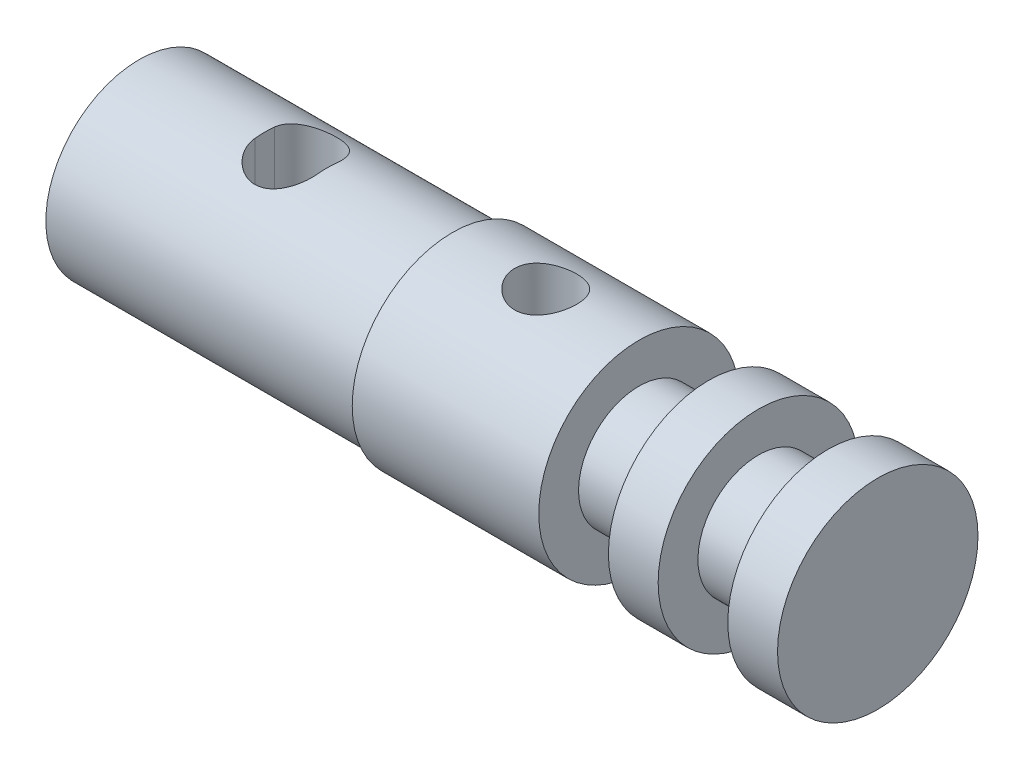
from build123d import *

# Parameters (mm, degrees)
F_1_8_0_125_DIAMETER_HOLE1_D   = 3.175
F_1_8_START                    = -4.7625001
F_1_8_0_1250_DOWEL_SLOT1_DEPTH = 9.5250001


# Read off the part's stored shape, not the designer's step: 1/8 (0.1250) Dowel Slot1
with BuildPart() as part:
    # Sketch1 → Revolve1 (revolve)
    with BuildSketch(Plane.XY, mode=Mode.PRIVATE) as revolve1_sk:
        Polygon((-18.8585, 0), (18.8585, 0), (18.8585, 5.1181), (16.3185, 5.1181), (16.3185, 3.0861), (12.7625, 3.0861), (12.7625, 5.1181), (10.2225, 5.1181), (10.2225, 3.0861), (6.6665, 3.0861), (6.6665, 5.1181), (-2.8585, 5.1181), (-2.8585, 4.7625), (-18.8585, 4.7625), align=None)
    revolve(revolve1_sk.sketch.rotate(Axis((-18.8585, 0, 0), (1, 0, 0)), 180), axis=Axis((-18.8585, 0, 0), (1, 0, 0)))

    # 1/8 (0.125) Diameter Hole1 (through all)
    with Locations(Plane(origin=(0, -5.1181, 0), x_dir=(-1, 0, 0), z_dir=(0, -1, 0))):
        with Locations((-1.904, 0)):
            Hole(F_1_8_0_125_DIAMETER_HOLE1_D / 2)

    # 1/8 (0.1250) Dowel Slot1 outline → 1/8 (0.1250) Dowel Slot1 (cut)
    with BuildSketch(Plane(origin=(0, 0, 0), x_dir=(1, 0, 0), z_dir=(0, 1, 0)).offset(F_1_8_START)):
        with BuildLine():
            ThreePointArc((-9.271, 0.499999), (-10.8585, 2.087499), (-12.446, 0.499999))
            Line((-12.446, 0.499999), (-12.446, -0.499999))
            ThreePointArc((-12.446, -0.499999), (-10.8585, -2.087499), (-9.271, -0.499999))
            Line((-9.271, -0.499999), (-9.271, 0.499999))
        make_face()
    extrude(amount=F_1_8_0_1250_DOWEL_SLOT1_DEPTH, mode=Mode.SUBTRACT)


solid = part.part
